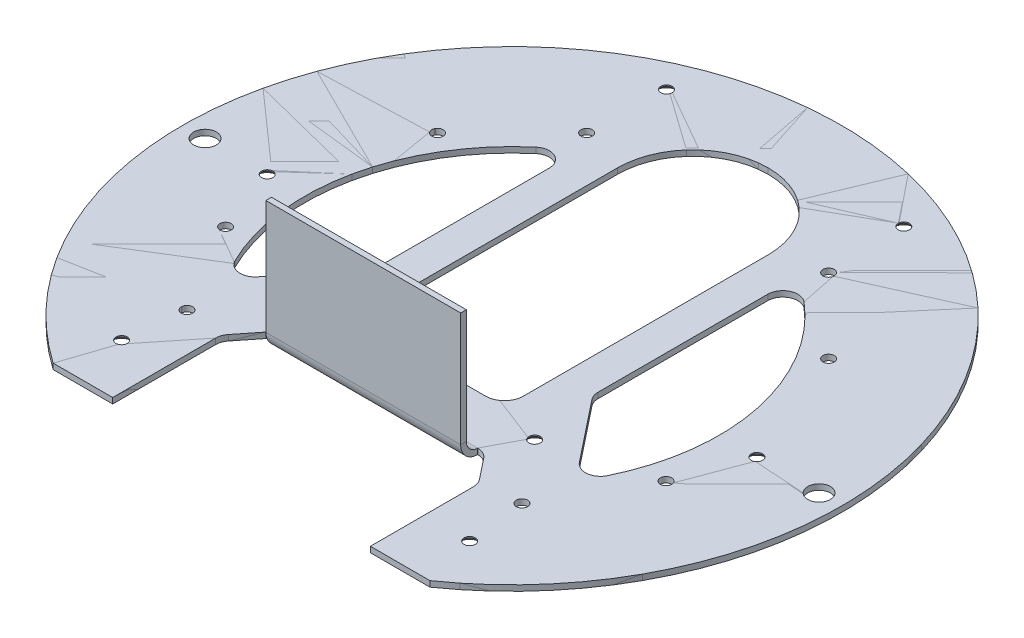
from build123d import *

# Parameters (mm, degrees)
RESSALTO_EXTRUS_O1_DEPTH      = 1.5
ESBO_O2_R                     = 1.5
CORTE_EXTRUS_O1_DEPTH         = 124.752777747
CORTE_EXTRUS_O2_REACH         = 125.753
ESBO_O3_R                     = 3
CORTE_EXTRUS_O3_REACH         = 125.753
ESBO_O4_R                     = 1.5
CORTE_EXTRUS_O4_REACH         = 125.753
ESBO_O5_R                     = 1.5
RESSALTO_EXTRUS_O2_START      = -1.5
RESSALTO_EXTRUS_O2_DEPTH      = 1.5
FILETE1_R                     = 4
CORTE_EXTRUS_O5_REACH         = 125.753
ESBO_O8_W                     = 40
ESBO_O8_H                     = 90
FILETE2_R                     = 20
FILETE3_R                     = 5
CORTE_EXTRUS_O6_REACH         = 125.753
ESBO_O9_R                     = 1.5
CONVERTER_S_LIDO1_OUTLINE_R   = 1.5
CONVERTER_S_LIDO1_OUTLINE_R_2 = 3
CONVERTER_S_LIDO1_DEPTH       = 1.5
ARESTA_FLANGE1_DEPTH          = 51.715784199
CHANFRO2_SIZE                 = 1.2
CHANFRO4_SIZE                 = 1.2


# Read off the part's stored shape, not the designer's step: Converter-Sólido1
# Sheet-metal steps are written as plain solids
with BuildPart() as part:
    # Esboço1 → Ressalto-extrusão1 (new body)
    with BuildSketch(Plane(origin=(0, 0, 0), x_dir=(1, 0, 0), z_dir=(0, 1, 0))):
        with BuildLine():
            Line((-34.2, -43.073890003), (-34.2, -71.807033082))
            Line((-34.2, -71.807033082), (-50, -71.807033082))
            ThreePointArc((-50, -71.807033082), (0, 87.5), (50, -71.807033082))
            Line((50, -71.807033082), (34.2, -71.807033082))
            Line((34.2, -71.807033082), (34.2, -43.073890003))
            ThreePointArc((34.2, -43.073890003), (0, 55), (-34.2, -43.073890003))
        make_face()
    extrude(amount=RESSALTO_EXTRUS_O1_DEPTH)

    # Esboço2 → Corte-extrusão1 (cut, through all)
    with BuildSketch(Plane(origin=(0, 1.5, 0), x_dir=(1, 0, 0), z_dir=(0, 1, 0))):
        with Locations(Location((-44.461863837, -41.835876592, 0), (0, 0, 270))):
            Circle(ESBO_O2_R)
        with Locations(Location((-58.461863837, -17.587165286, 0), (0, 0, 270))):
            Circle(ESBO_O2_R)
        with Locations(Location((-51.917930808, 32.118940934, 0), (0, 0, 270))):
            Circle(ESBO_O2_R)
        with Locations(Location((-32.118940934, 51.917930808, 0), (0, 0, 270))):
            Circle(ESBO_O2_R)
        with Locations(Location((32.118940934, 51.917930808, 0), (0, 0, 270))):
            Circle(ESBO_O2_R)
        with Locations(Location((51.917930808, 32.118940934, 0), (0, 0, 270))):
            Circle(ESBO_O2_R)
        with Locations(Location((58.461863837, -17.587165286, 0), (0, 0, 270))):
            Circle(ESBO_O2_R)
        with Locations(Location((44.461863837, -41.835876592, 0), (0, 0, 270))):
            Circle(ESBO_O2_R)
    extrude(amount=-CORTE_EXTRUS_O1_DEPTH, mode=Mode.SUBTRACT)

    # Esboço3 → Corte-extrusão2 (cut, up to next)
    with BuildSketch(Plane.XZ, mode=Mode.PRIVATE) as corte_extrus_o2_sk1:
        with Locations(Location((81.5, 0, 0), (0, 0, 270))):
            Circle(ESBO_O3_R)
    corte_extrus_o2_tool1 = extrude(corte_extrus_o2_sk1.sketch, amount=-CORTE_EXTRUS_O2_REACH, mode=Mode.PRIVATE) & part.part
    # Esboço3 → Corte-extrusão2 (cut, up to next)
    with BuildSketch(Plane.XZ, mode=Mode.PRIVATE) as corte_extrus_o2_sk2:
        with Locations(Location((-81.5, 0, 0), (0, 0, 270))):
            Circle(ESBO_O3_R)
    corte_extrus_o2_tool2 = extrude(corte_extrus_o2_sk2.sketch, amount=-CORTE_EXTRUS_O2_REACH, mode=Mode.PRIVATE) & part.part
    add(corte_extrus_o2_tool1.solids().sort_by_distance((81.5, 0, 0))[0], mode=Mode.SUBTRACT)
    add(corte_extrus_o2_tool2.solids().sort_by_distance((-81.5, 0, 0))[0], mode=Mode.SUBTRACT)

    # Esboço4 → Corte-extrusão3 (cut, up to next)
    with BuildSketch(Plane(origin=(0, 1.5, 0), x_dir=(1, 0, 0), z_dir=(0, 1, 0)), mode=Mode.PRIVATE) as corte_extrus_o3_sk1:
        with Locations(Location((-65, 0, 0), (0, 0, 270))):
            Circle(ESBO_O4_R)
    corte_extrus_o3_tool1 = extrude(corte_extrus_o3_sk1.sketch, amount=-CORTE_EXTRUS_O3_REACH, mode=Mode.PRIVATE) & part.part
    # Esboço4 → Corte-extrusão3 (cut, up to next)
    with BuildSketch(Plane(origin=(0, 1.5, 0), x_dir=(1, 0, 0), z_dir=(0, 1, 0)), mode=Mode.PRIVATE) as corte_extrus_o3_sk2:
        with Locations(Location((65, 0, 0), (0, 0, 270))):
            Circle(ESBO_O4_R)
    corte_extrus_o3_tool2 = extrude(corte_extrus_o3_sk2.sketch, amount=-CORTE_EXTRUS_O3_REACH, mode=Mode.PRIVATE) & part.part
    add(corte_extrus_o3_tool1.solids().sort_by_distance((-65, 1.5, 0))[0], mode=Mode.SUBTRACT)
    add(corte_extrus_o3_tool2.solids().sort_by_distance((65, 1.5, 0))[0], mode=Mode.SUBTRACT)

    # Esboço5 → Corte-extrusão4 (cut, up to next)
    with BuildSketch(Plane(origin=(0, 1.5, 0), x_dir=(1, 0, 0), z_dir=(0, 1, 0)), mode=Mode.PRIVATE) as corte_extrus_o4_sk1:
        with Locations(Location((46.2, -57.440461542, 0), (0, 0, 270))):
            Circle(ESBO_O5_R)
    corte_extrus_o4_tool1 = extrude(corte_extrus_o4_sk1.sketch, amount=-CORTE_EXTRUS_O4_REACH, mode=Mode.PRIVATE) & part.part
    # Esboço5 → Corte-extrusão4 (cut, up to next)
    with BuildSketch(Plane(origin=(0, 1.5, 0), x_dir=(1, 0, 0), z_dir=(0, 1, 0)), mode=Mode.PRIVATE) as corte_extrus_o4_sk2:
        with Locations(Location((-46.2, -57.440461542, 0), (0, 0, 270))):
            Circle(ESBO_O5_R)
    corte_extrus_o4_tool2 = extrude(corte_extrus_o4_sk2.sketch, amount=-CORTE_EXTRUS_O4_REACH, mode=Mode.PRIVATE) & part.part
    add(corte_extrus_o4_tool1.solids().sort_by_distance((46.2, 1.5, 57.440462))[0], mode=Mode.SUBTRACT)
    add(corte_extrus_o4_tool2.solids().sort_by_distance((-46.2, 1.5, 57.440462))[0], mode=Mode.SUBTRACT)

    # Esboço6 → Ressalto-extrusão2 (add)
    with BuildSketch(Plane(origin=(0, 1.5, 0), x_dir=(1, 0, 0), z_dir=(0, 1, 0)).offset(RESSALTO_EXTRUS_O2_START)):
        with BuildLine():
            ThreePointArc((29, 46.733285782), (0, 55), (-29, 46.733285782))
            Line((-29, 46.733285782), (-29, -7.577275149))
            Line((-29, -7.577275149), (-46.413512869, -29.509080351))
            ThreePointArc((-46.413512869, -29.509080351), (-40.87340981, -36.801689778), (-34.2, -43.073890003))
            Line((-34.2, -43.073890003), (-27.789456673, -35))
            Line((-27.789456673, -35), (27.789456673, -35))
            Line((27.789456673, -35), (34.2, -43.073890003))
            ThreePointArc((34.2, -43.073890003), (40.87340981, -36.801689778), (46.413512869, -29.509080351))
            Line((46.413512869, -29.509080351), (29, -7.577275149))
            Line((29, -7.577275149), (29, 46.733285782))
        make_face()
    extrude(amount=RESSALTO_EXTRUS_O2_DEPTH)

    # Filete1
    filete1_edges = [part.edges().sort_by_distance(p)[0] for p in [
        (34.2, 0.75, 43.073890003),
        (-34.2, 0.75, 43.073890003),
        (29, 0.75, 7.577275149),
        (46.413512869, 0.75, 29.509080351),
        (27.789456673, 0.75, 35),
        (-27.789456673, 0.75, 35),
        (-46.413512869, 0.75, 29.509080351),
        (-29, 0.75, 7.577275149),
        (-29, 0.75, -46.733285782),
        (29, 0.75, -46.733285782),
    ]]
    fillet(filete1_edges, radius=FILETE1_R)

    # Esboço8 → Corte-extrusão5 (cut, up to next)
    with BuildSketch(Plane(origin=(0, 1.5, 0), x_dir=(1, 0, 0), z_dir=(0, 1, 0)), mode=Mode.PRIVATE) as corte_extrus_o5_sk1:
        with Locations((0, 23)):
            Rectangle(ESBO_O8_W, ESBO_O8_H)
    corte_extrus_o5_tool1 = extrude(corte_extrus_o5_sk1.sketch, amount=-CORTE_EXTRUS_O5_REACH, mode=Mode.PRIVATE) & part.part
    add(corte_extrus_o5_tool1.solids().sort_by_distance((0, 1.5, -23))[0], mode=Mode.SUBTRACT)

    # Filete2
    filete2_edges = [part.edges().sort_by_distance(p)[0] for p in [
        (-20, 0.75, -68),
        (20, 0.75, -68),
    ]]
    fillet(filete2_edges, radius=FILETE2_R - 0.0001)  # a hair under: the kernel refuses the full size

    # Filete3
    filete3_edges = [part.edges().sort_by_distance(p)[0] for p in [
        (20, 0.75, 22),
        (-20, 0.75, 22),
    ]]
    fillet(filete3_edges, radius=FILETE3_R)

    # Esboço9 → Corte-extrusão6 (cut, up to next)
    with BuildSketch(Plane(origin=(0, 1.5, 0), x_dir=(1, 0, 0), z_dir=(0, 1, 0)), mode=Mode.PRIVATE) as corte_extrus_o6_sk1:
        with Locations(Location((-31.5, 72.5, 0), (0, 0, 270))):
            Circle(ESBO_O9_R)
    corte_extrus_o6_tool1 = extrude(corte_extrus_o6_sk1.sketch, amount=-CORTE_EXTRUS_O6_REACH, mode=Mode.PRIVATE) & part.part
    # Esboço9 → Corte-extrusão6 (cut, up to next)
    with BuildSketch(Plane(origin=(0, 1.5, 0), x_dir=(1, 0, 0), z_dir=(0, 1, 0)), mode=Mode.PRIVATE) as corte_extrus_o6_sk2:
        with Locations(Location((31.5, 72.5, 0), (0, 0, 270))):
            Circle(ESBO_O9_R)
    corte_extrus_o6_tool2 = extrude(corte_extrus_o6_sk2.sketch, amount=-CORTE_EXTRUS_O6_REACH, mode=Mode.PRIVATE) & part.part
    # Esboço9 → Corte-extrusão6 (cut, up to next)
    with BuildSketch(Plane(origin=(0, 1.5, 0), x_dir=(1, 0, 0), z_dir=(0, 1, 0)), mode=Mode.PRIVATE) as corte_extrus_o6_sk3:
        with Locations(Location((31.5, -25.5, 0), (0, 0, 270))):
            Circle(ESBO_O9_R)
    corte_extrus_o6_tool3 = extrude(corte_extrus_o6_sk3.sketch, amount=-CORTE_EXTRUS_O6_REACH, mode=Mode.PRIVATE) & part.part
    # Esboço9 → Corte-extrusão6 (cut, up to next)
    with BuildSketch(Plane(origin=(0, 1.5, 0), x_dir=(1, 0, 0), z_dir=(0, 1, 0)), mode=Mode.PRIVATE) as corte_extrus_o6_sk4:
        with Locations(Location((-31.5, -25.5, 0), (0, 0, 270))):
            Circle(ESBO_O9_R)
    corte_extrus_o6_tool4 = extrude(corte_extrus_o6_sk4.sketch, amount=-CORTE_EXTRUS_O6_REACH, mode=Mode.PRIVATE) & part.part
    add(corte_extrus_o6_tool1.solids().sort_by_distance((-31.5, 1.5, -72.5))[0], mode=Mode.SUBTRACT)
    add(corte_extrus_o6_tool2.solids().sort_by_distance((31.5, 1.5, -72.5))[0], mode=Mode.SUBTRACT)
    add(corte_extrus_o6_tool3.solids().sort_by_distance((31.5, 1.5, 25.5))[0], mode=Mode.SUBTRACT)
    add(corte_extrus_o6_tool4.solids().sort_by_distance((-31.5, 1.5, 25.5))[0], mode=Mode.SUBTRACT)

    # Chanfro2
    chanfro2_edges = [part.edges().sort_by_distance(p)[0] for p in [
        (-31.5, 0, -74),
        (31.5, 0, -74),
        (31.5, 0, 24),
        (-31.5, 0, 24),
        (-65, 0, -1.5),
        (65, 0, -1.5),
        (46.2, 0, 55.940461542),
        (-46.2, 0, 55.940461542),
    ]]
    chamfer(chanfro2_edges, length=CHANFRO2_SIZE)


with BuildPart() as body_2:
    # Converter-Sólido1 outline → Converter-Sólido1 (new body)
    with BuildSketch(Plane(origin=(0, 0, 0), x_dir=(1, 0, 0), z_dir=(0, 1, 0))):
        with BuildLine():
            ThreePointArc((50, -71.807033082), (0, 87.5), (-50, -71.807033082))
            Line((-50, -71.807033082), (-34.2, -71.807033082))
            Line((-34.2, -71.807033082), (-34.2, -44.468756669))
            ThreePointArc((-34.2, -44.468756669), (-33.976942294, -43.151673943), (-33.332646546, -41.981483942))
            Line((-33.332646546, -41.981483942), (-28.990538645, -36.512727273))
            ThreePointArc((-28.990538645, -36.512727273), (-27.59727548, -35.397980364), (-25.857892099, -35))
            Line((-25.857892099, -35), (25.857892099, -35))
            ThreePointArc((25.857892099, -35), (27.59727548, -35.397980364), (28.990538645, -36.512727273))
            Line((28.990538645, -36.512727273), (33.332646546, -41.981483942))
            ThreePointArc((33.332646546, -41.981483942), (33.976942294, -43.151673943), (34.2, -44.468756669))
            Line((34.2, -44.468756669), (34.2, -71.807033082))
            Line((34.2, -71.807033082), (50, -71.807033082))
        make_face()
        with Locations((-46.2, -57.440461542)):
            Circle(CONVERTER_S_LIDO1_OUTLINE_R, mode=Mode.SUBTRACT)
        with Locations((-44.461863837, -41.835876592)):
            Circle(CONVERTER_S_LIDO1_OUTLINE_R, mode=Mode.SUBTRACT)
        with Locations((-58.461863837, -17.587165286)):
            Circle(CONVERTER_S_LIDO1_OUTLINE_R, mode=Mode.SUBTRACT)
        with Locations((-81.5, 0)):
            Circle(CONVERTER_S_LIDO1_OUTLINE_R_2, mode=Mode.SUBTRACT)
        with Locations((-65, 0)):
            Circle(CONVERTER_S_LIDO1_OUTLINE_R, mode=Mode.SUBTRACT)
        with Locations((-31.5, -25.5)):
            Circle(CONVERTER_S_LIDO1_OUTLINE_R, mode=Mode.SUBTRACT)
        with Locations((46.2, -57.440461542)):
            Circle(CONVERTER_S_LIDO1_OUTLINE_R, mode=Mode.SUBTRACT)
        with Locations((44.461863837, -41.835876592)):
            Circle(CONVERTER_S_LIDO1_OUTLINE_R, mode=Mode.SUBTRACT)
        with Locations((31.5, -25.5)):
            Circle(CONVERTER_S_LIDO1_OUTLINE_R, mode=Mode.SUBTRACT)
        with Locations((58.461863837, -17.587165286)):
            Circle(CONVERTER_S_LIDO1_OUTLINE_R, mode=Mode.SUBTRACT)
        with Locations((65, 0)):
            Circle(CONVERTER_S_LIDO1_OUTLINE_R, mode=Mode.SUBTRACT)
        with Locations((81.5, 0)):
            Circle(CONVERTER_S_LIDO1_OUTLINE_R_2, mode=Mode.SUBTRACT)
        with Locations((-51.917930808, 32.118940934)):
            Circle(CONVERTER_S_LIDO1_OUTLINE_R, mode=Mode.SUBTRACT)
        with BuildLine():
            ThreePointArc((-42.707303914, -24.841219624), (-46.273778612, -26.330351445), (-49.435240692, -24.107197633))
            ThreePointArc((-49.435240692, -24.107197633), (-53.829495323, 11.28651555), (-35.588235294, 41.934204519))
            ThreePointArc((-35.588235294, 41.934204519), (-31.319663899, 42.514385042), (-29, 38.88444419))
            Line((-29, 38.88444419), (-29, -6.182408483))
            ThreePointArc((-29, -6.182408483), (-29.223057706, -7.499491209), (-29.867353454, -8.66968121))
            Line((-29.867353454, -8.66968121), (-42.707303914, -24.841219624))
        make_face(mode=Mode.SUBTRACT)
        with BuildLine():
            Line((20, 48), (20, -17))
            ThreePointArc((20, -17), (18.535533906, -20.535533906), (15, -22))
            Line((15, -22), (-15, -22))
            ThreePointArc((-15, -22), (-18.535533906, -20.535533906), (-20, -17))
            Line((-20, -17), (-20, 48))
            ThreePointArc((-20, 48), (-14.142135624, 62.142135624), (0, 68))
            ThreePointArc((0, 68), (14.142135624, 62.142135624), (20, 48))
        make_face(mode=Mode.SUBTRACT)
        with Locations((-32.118940934, 51.917930808)):
            Circle(CONVERTER_S_LIDO1_OUTLINE_R, mode=Mode.SUBTRACT)
        with Locations((-31.5, 72.5)):
            Circle(CONVERTER_S_LIDO1_OUTLINE_R, mode=Mode.SUBTRACT)
        with BuildLine():
            ThreePointArc((29, 38.88444419), (31.319663899, 42.514385042), (35.588235294, 41.934204519))
            ThreePointArc((35.588235294, 41.934204519), (53.829495323, 11.28651555), (49.435240692, -24.107197633))
            ThreePointArc((49.435240692, -24.107197633), (46.273778612, -26.330351445), (42.707303914, -24.841219624))
            Line((42.707303914, -24.841219624), (29.867353454, -8.66968121))
            ThreePointArc((29.867353454, -8.66968121), (29.223057706, -7.499491209), (29, -6.182408483))
            Line((29, -6.182408483), (29, 38.88444419))
        make_face(mode=Mode.SUBTRACT)
        with Locations((51.917930808, 32.118940934)):
            Circle(CONVERTER_S_LIDO1_OUTLINE_R, mode=Mode.SUBTRACT)
        with Locations((32.118940934, 51.917930808)):
            Circle(CONVERTER_S_LIDO1_OUTLINE_R, mode=Mode.SUBTRACT)
        with Locations((31.5, 72.5)):
            Circle(CONVERTER_S_LIDO1_OUTLINE_R, mode=Mode.SUBTRACT)
    extrude(amount=CONVERTER_S_LIDO1_DEPTH)

    # Aresta-Flange1 section (across the edge) → Aresta-Flange1 (add)
    with BuildSketch(Plane(origin=(-25.857892099, 1.5, 38), x_dir=(0, 0, -1), z_dir=(1, 0, 0))):
        with BuildLine():
            Line((-1.5, 3), (-1.5, 33.31))
            Line((-1.5, 33.31), (0, 33.31))
            Line((0, 33.31), (0, 3))
            ThreePointArc((0, 3), (0.878679656, 0.878679656), (3, 0))
            Line((3, 0), (3, -1.5))
            ThreePointArc((3, -1.5), (-0.181980515, -0.181980515), (-1.5, 3))
        make_face()
    extrude(amount=ARESTA_FLANGE1_DEPTH)

    # Chanfro4
    chanfro4_edges = [body_2.edges().sort_by_distance(p)[0] for p in [
        (-66.5, 0, 0),
        (63.5, 0, 0),
        (44.7, 0, 57.440461542),
        (-47.7, 0, 57.440461542),
        (-33, 0, -72.5),
        (30, 0, -72.5),
        (30, 0, 25.5),
        (-33, 0, 25.5),
    ]]
    chamfer(chanfro4_edges, length=CHANFRO4_SIZE)


solid = Compound([part.part, body_2.part])
